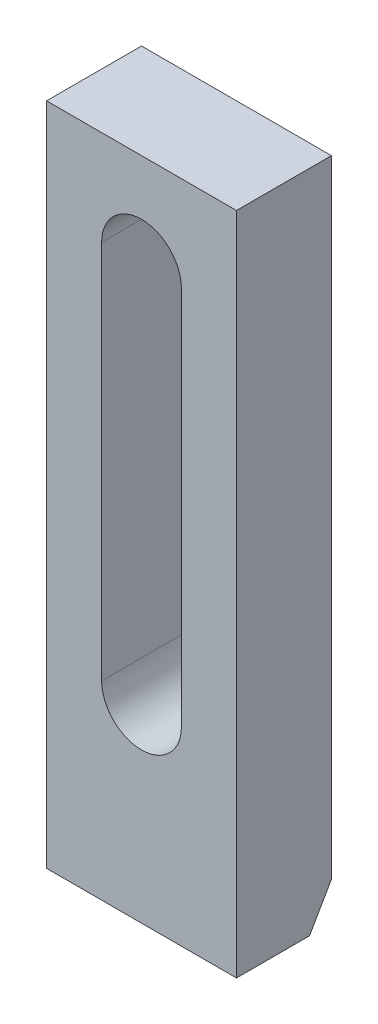
from build123d import *

# Parameters (mm, degrees)
SKETCH_1_W          = 50
SKETCH_1_H          = 175
EXTRUDE_1_DEPTH     = 25
CUT_EXTRUDE_1_DEPTH = 184.711730709
CHAMFER_1_SIZE      = 10
CHAMFER_1_SIZE2     = 5.773502692


with BuildPart() as part:
    # Эскиз1 → Бобышка-Вытянуть1 (new body)
    with BuildSketch(Plane.XY):
        with Locations((25, 87.5)):
            Rectangle(SKETCH_1_W, SKETCH_1_H)
    extrude(amount=EXTRUDE_1_DEPTH)

    # Эскиз2 → Вырез-Вытянуть1 (cut, through all)
    with BuildSketch(Plane.XY.offset(25)):
        with BuildLine():
            Line((14.5, 50), (14.5, 150))
            ThreePointArc((14.5, 150), (25, 160.5), (35.5, 150))
            Line((35.5, 150), (35.5, 50))
            ThreePointArc((35.5, 50), (25, 39.5), (14.5, 50))
        make_face()
    extrude(amount=-CUT_EXTRUDE_1_DEPTH, mode=Mode.SUBTRACT)

    # Фаска1
    chamfer_1_edges = [part.edges().sort_by_distance(p)[0] for p in [
        (25, 0, 0),
    ]]
    chamfer_1_side = [part.faces().sort_by_distance(p)[0] for p in [
        (25, 1.820027472, 0),
    ]]
    chamfer(chamfer_1_edges, length=CHAMFER_1_SIZE, length2=CHAMFER_1_SIZE2, reference=chamfer_1_side[0])


solid = part.part
